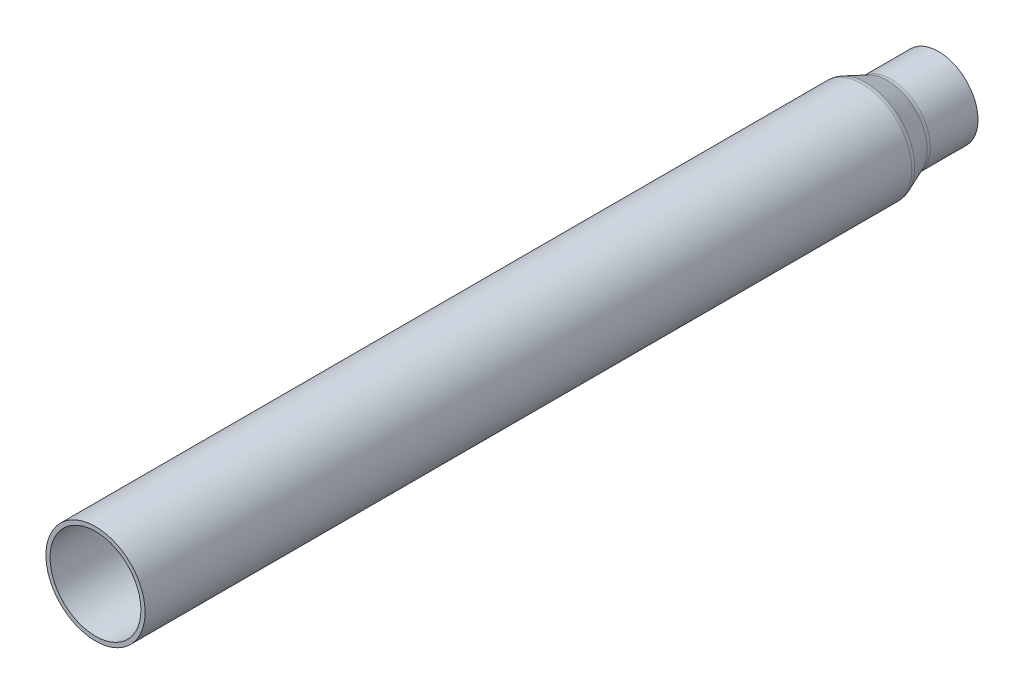
from build123d import *

# Parameters (mm, degrees)
FILLET1_R = 2.54


with BuildPart() as part:
    # Sketch1 → Revolve1 (revolve)
    with BuildSketch(Plane(origin=(0, 0, 0), x_dir=(1, 0, 0), z_dir=(0, 1, 0))):
        Polygon((10.1092, 50.8), (10.1092, 38.1), (12.7, 31.75), (12.7, -165.1), (11.6332, -165.1), (11.6332, 31.75), (9.0424, 38.1), (9.0424, 50.8), align=None)
    revolve(axis=Axis((0, 0, 0), (0, 0, -1)))

    # Fillet1
    fillet1_edges = [part.edges().sort_by_distance(p)[0] for p in [
        (-9.0424, 0, -38.1),
        (-10.1092, 0, -38.1),
        (-11.6332, 0, -31.75),
        (-12.7, 0, -31.75),
    ]]
    fillet(fillet1_edges, radius=FILLET1_R)


solid = part.part
